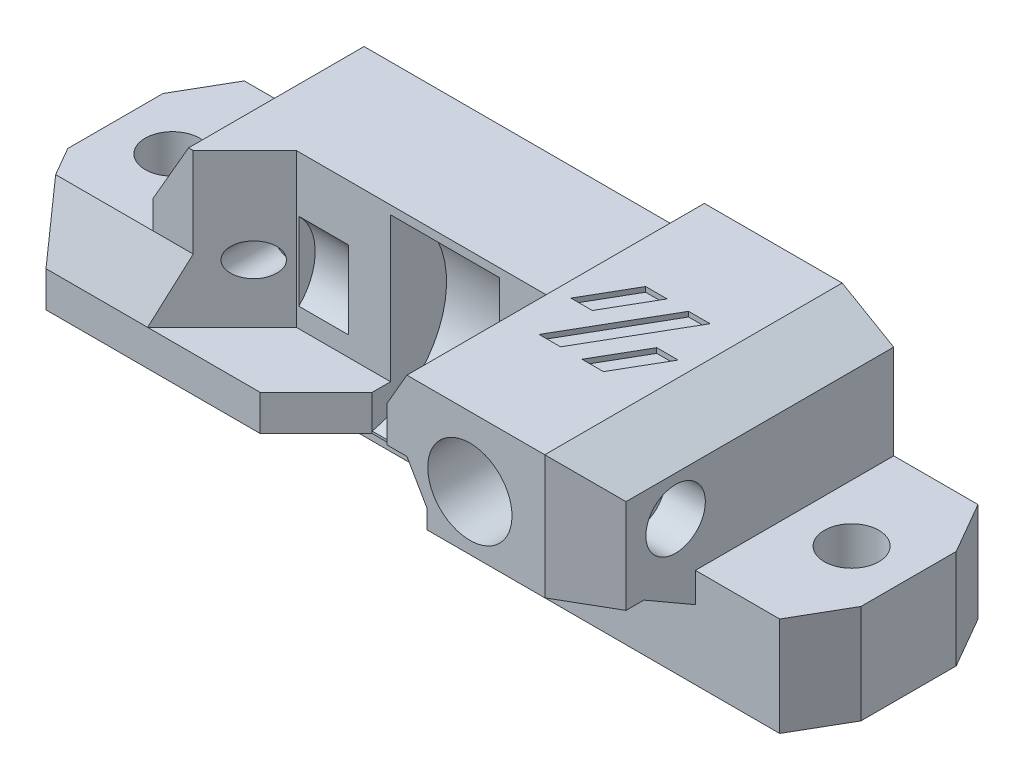
from build123d import *
from OCP.BRepFilletAPI import BRepFilletAPI_MakeChamfer

# Parameters (mm, degrees)
AUFSATZ_LINEAR_AUSTRAGEN1_DEPTH       = 80
SKIZZE2_R                             = 4.25
SCHNITT_LINEAR_AUSTRAGEN1_DEPTH       = 30
SKIZZE3_R                             = 1.65
SCHNITT_LINEAR_AUSTRAGEN2_DEPTH       = 17.5
SKIZZE4_R                             = 1.65
SCHNITT_LINEAR_AUSTRAGEN3_DEPTH       = 30
SCHNITT_LINEAR_START                  = -22.5
SKIZZE5_R                             = 2.75
SCHNITT_LINEAR_AUSTRAGEN4_DEPTH       = 22.5
SKIZZE6_R                             = 2.75
SCHNITT_LINEAR_AUSTRAGEN5_DEPTH       = 10
SCHNITT_LINEAR_AUSTRAGEN6_DEPTH       = 9.5
SCHNITT_LINEAR_START_2                = -12.5
SKIZZE8_W                             = 11.5
SKIZZE8_H                             = 12.5
SCHNITT_LINEAR_AUSTRAGEN7_DEPTH       = 30
SCHNITT_LINEAR_START_3                = 10.2
SKIZZE9_W                             = 4.714359354
SKIZZE9_H                             = 17.5
SCHNITT_LINEAR_AUSTRAGEN8_DEPTH       = 11
SCHNITT_LINEAR_START_4                = 25.45
SKIZZE10_R                            = 5.5
SCHNITT_LINEAR_AUSTRAGEN9_DEPTH       = 5
AUFSATZ_LINEAR_START                  = -19.04526
AUFSATZ_LINEAR_AUSTRAGEN2_DEPTH       = 15.44526
SCHNITT_LINEAR_START_5                = -20.5
SKIZZE12_R                            = 1.65
SCHNITT_LINEAR_AUSTRAGEN10_DEPTH      = 20.5
FASE1_SIZE                            = 1.6
SKIZZE15_W                            = 20
SKIZZE15_H                            = 10
SCHNITT_LINEAR_AUSTRAGEN12_DEPTH      = 80
SCHNITT_LINEAR_AUSTRAGEN13_REACH      = 86.633
SKIZZE17_W                            = 49.404551733
SKIZZE17_H                            = 10
SCHNITT_LINEAR_AUSTRAGEN14_DEPTH      = 3.6
AUFSATZ_LINEAR_AUSTRAGEN3_REACH       = 87.477
SKIZZE21_W                            = 10
SKIZZE21_H                            = 10
SCHNITT_LINEAR_AUSTRAGEN18_DEPTH      = 30.595448267
SCHNITT_LINEAR_AUSTRAGEN19_REACH      = 76.823
SCHNITT_LINEAR_AUSTRAGEN19_END_RADIUS = 4.25
SKIZZE22_R                            = 2.25
SKIZZE23_R                            = 3
SCHNITT_LINEAR_AUSTRAGEN20_DEPTH      = 4
FASE2_SIZE                            = 3
FASE2_SIZE2                           = 5.196152423
AUFSATZ_LINEAR_START_2                = -17
AUFSATZ_LINEAR_AUSTRAGEN4_DEPTH       = 46
FASE3_SIZE                            = 3
FASE3_SIZE2                           = 5.196152423
FASE4_SIZE                            = 3
FASE4_SIZE2                           = 5.196152423
SCHNITT_LINEAR_AUSTRAGEN22_DEPTH      = 0.5
SCHNITT_LINEAR_AUSTRAGEN23_REACH      = 87.477
K_RPER_VERSCHIEBEN_KOPIEREN1_ANGLE    = 90


with BuildPart() as part:
    # Skizze1 → Aufsatz-Linear austragen1 (new body)
    with BuildSketch(Plane(origin=(0, 0, 0), x_dir=(0, 0, -1), z_dir=(1, 0, 0))):
        Polygon((0, 0), (0, 20), (-22.5, 20), (-22.5, -10), (20, -10), (20, 0), align=None)
    extrude(amount=AUFSATZ_LINEAR_AUSTRAGEN1_DEPTH)

    # Skizze2 → Schnitt-Linear austragen1 (cut)
    with BuildSketch(Plane(origin=(0, 20, 0), x_dir=(1, 0, 0), z_dir=(0, 1, 0))):
        with Locations(Location((55.75, -15.5, 0), (0, 0, 270))):
            Circle(SKIZZE2_R)
    extrude(amount=-SCHNITT_LINEAR_AUSTRAGEN1_DEPTH, mode=Mode.SUBTRACT)

    # Skizze3 → Schnitt-Linear austragen2 (cut)
    with BuildSketch(Plane.XZ.offset(10)):
        Polygon((49.399147039, 22.5), (47.404551733, 19.045259589), (47.404551733, 15.4), (49.404551733, 15.4), (51.45, 11.857179677), (51.45, 7.142820323), (49.404551733, 3.6), (17.595448267, 3.6), (15.55, 7.142820323), (15.55, 11.857179677), (17.595448267, 15.4), (19.595448267, 15.4), (19.595448267, 19.045259589), (0, 19.045259589), (0, 22.5), align=None)
        with Locations(Location((48.4, 9.5, 0), (0, 0, 270))):
            Circle(SKIZZE3_R, mode=Mode.SUBTRACT)
        with Locations(Location((18.6, 9.5, 0), (0, 0, 270))):
            Circle(SKIZZE3_R, mode=Mode.SUBTRACT)
    extrude(amount=-SCHNITT_LINEAR_AUSTRAGEN2_DEPTH, mode=Mode.SUBTRACT)

    # Skizze4 → Schnitt-Linear austragen3 (cut)
    with BuildSketch(Plane.XZ.offset(10)):
        with Locations(Location((18.6, 9.5, 0), (0, 0, 270))):
            Circle(SKIZZE4_R)
        with Locations(Location((48.4, 9.5, 0), (0, 0, 270))):
            Circle(SKIZZE4_R)
    extrude(amount=-SCHNITT_LINEAR_AUSTRAGEN3_DEPTH, mode=Mode.SUBTRACT)

    # Skizze5 → Schnitt-Linear austragen4 (cut)
    with BuildSketch(Plane(origin=(0, 0, 0), x_dir=(-1, 0, 0), z_dir=(0, 0, -1)).offset(SCHNITT_LINEAR_START)):
        with Locations((-5.75, 10)):
            Circle(SKIZZE5_R)
        with Locations((-74.25, 10)):
            Circle(SKIZZE5_R)
    extrude(amount=SCHNITT_LINEAR_AUSTRAGEN4_DEPTH, mode=Mode.SUBTRACT)

    # Skizze6 → Schnitt-Linear austragen5 (cut)
    with BuildSketch(Plane(origin=(0, 0, 0), x_dir=(1, 0, 0), z_dir=(0, 1, 0))):
        with Locations(Location((40, 10, 0), (0, 0, 270))):
            Circle(SKIZZE6_R)
    extrude(amount=-SCHNITT_LINEAR_AUSTRAGEN5_DEPTH, mode=Mode.SUBTRACT)

    # Skizze7 → Schnitt-Linear austragen6 (cut)
    with BuildSketch(Plane(origin=(0, 20, 0), x_dir=(1, 0, 0), z_dir=(0, 1, 0))):
        Polygon((21.890896534, -9.5), (20.245448267, -6.65), (16.954551733, -6.65), (15.309103466, -9.5), (16.954551733, -12.35), (20.245448267, -12.35), align=None)
        Polygon((51.690896534, -9.5), (50.045448267, -6.65), (46.754551733, -6.65), (45.109103466, -9.5), (46.754551733, -12.35), (50.045448267, -12.35), align=None)
    extrude(amount=-SCHNITT_LINEAR_AUSTRAGEN6_DEPTH, mode=Mode.SUBTRACT)

    # Skizze8 → Schnitt-Linear austragen7 (cut)
    with BuildSketch(Plane.XZ.offset(-7.5).offset(SCHNITT_LINEAR_START_2)):
        Polygon((49.399147039, 22.5), (47.404551733, 19.045259589), (15.081237719, 19.045259589), (11.5, 12.842373906), (11.5, 10), (0, 10), (0, 22.5), align=None)
        with Locations((74.25, 16.25)):
            Rectangle(SKIZZE8_W, SKIZZE8_H)
    extrude(amount=SCHNITT_LINEAR_AUSTRAGEN7_DEPTH, mode=Mode.SUBTRACT)

    # Skizze9 → Schnitt-Linear austragen8 (cut)
    with BuildSketch(Plane.ZY.offset(-51.45).offset(SCHNITT_LINEAR_START_3)):
        with BuildLine():
            ThreePointArc((19, 3.65), (9.5, 13.15), (0, 3.65))
            Line((0, 3.65), (0, -10))
            Line((0, -10), (7.142820323, -10))
            Line((7.142820323, -10), (7.142820323, 7.5))
            Line((7.142820323, 7.5), (11.857179677, 7.5))
            Line((11.857179677, 7.5), (11.857179677, -10))
            Line((11.857179677, -10), (19, -10))
            Line((19, -10), (19, 3.65))
        make_face()
        with Locations((9.5, -1.25)):
            Rectangle(SKIZZE9_W, SKIZZE9_H)
    extrude(amount=SCHNITT_LINEAR_AUSTRAGEN8_DEPTH, mode=Mode.SUBTRACT)

    # Skizze10 → Schnitt-Linear austragen9 (cut)
    with BuildSketch(Plane.ZY.offset(-51.45).offset(SCHNITT_LINEAR_START_4)):
        with Locations((9.5, 3.65)):
            Circle(SKIZZE10_R)
    extrude(amount=SCHNITT_LINEAR_AUSTRAGEN9_DEPTH, mode=Mode.SUBTRACT)


with BuildPart() as aufsatz_linear_austragen2_tool:
    # Skizze11 → Aufsatz-Linear austragen2 (new body)
    with BuildSketch(Plane(origin=(0, 0, 0), x_dir=(-1, 0, 0), z_dir=(0, 0, -1)).offset(AUFSATZ_LINEAR_START)):
        Polygon((-15.55, 7.5), (-20.75, 7.5), (-15.55, 2.3), align=None)
        Polygon((-51.45, 2.3), (-46.25, 7.5), (-51.45, 7.5), align=None)
    extrude(amount=AUFSATZ_LINEAR_AUSTRAGEN2_DEPTH)


with BuildPart() as part_1:
    add(part.part)


with BuildPart() as part_2:
    # Aufsatz-Linear austragen2: joined with aufsatz_linear_austragen2_tool
    add(part_1.part.fuse(aufsatz_linear_austragen2_tool.part, tol=0.00001))

    # Skizze12 → Schnitt-Linear austragen10 (cut)
    with BuildSketch(Plane(origin=(0, 10.5, 0), x_dir=(1, 0, 0), z_dir=(0, 1, 0)).offset(SCHNITT_LINEAR_START_5)):
        with Locations(Location((18.6, -9.5, 0), (0, 0, 90))):
            Circle(SKIZZE12_R)
        with Locations(Location((48.4, -9.5, 0), (0, 0, 90))):
            Circle(SKIZZE12_R)
    extrude(amount=SCHNITT_LINEAR_AUSTRAGEN10_DEPTH, mode=Mode.SUBTRACT)

    # Fase1
    # the kernel refuses this chamfer: 1.6 mm, written as the material it takes off along each edge
    with BuildSketch(Plane(origin=(18.6, 10.5, 9.5), x_dir=(0, 0, -1), z_dir=(-1, 0, 0))) as fase1_piece_1_section:
        Polygon((1.65 + FASE1_SIZE, 0), (1.65, FASE1_SIZE), (1.65, 0), align=None)
    fase1_piece_1 = revolve(axis=Axis((18.6, 10.5, 9.5), (0, -1, 0)), mode=Mode.PRIVATE)
    fase1_piece_1 = split(fase1_piece_1, bisect_by=Plane(origin=(21.068172401, 10.5, 10.925), z_dir=(-0.8660254037844387, 0, -0.4999999999999999)), keep=Keep.TOP, mode=Mode.PRIVATE)
    fase1_piece_1 = split(fase1_piece_1, bisect_by=Plane(origin=(18.6, 10.5, 12.35), z_dir=(0, 0, -1)), keep=Keep.TOP, mode=Mode.PRIVATE)
    fase1_piece_1 = split(fase1_piece_1, bisect_by=Plane(origin=(21.068172401, 10.5, 8.075), z_dir=(-0.8660254037844402, 0, 0.49999999999999756)), keep=Keep.TOP, mode=Mode.PRIVATE)
    fase1_piece_1 = split(fase1_piece_1, bisect_by=Plane(origin=(16.131827599, 10.5, 10.925), z_dir=(0.8660254037844385, 0, -0.5000000000000002)), keep=Keep.TOP, mode=Mode.PRIVATE)
    fase1_piece_1 = split(fase1_piece_1, bisect_by=Plane(origin=(18.6, 10.5, 6.65), z_dir=(0, 0, 1)), keep=Keep.TOP, mode=Mode.PRIVATE)
    fase1_piece_1 = split(fase1_piece_1, bisect_by=Plane(origin=(16.131827599, 10.5, 8.075), z_dir=(0.8660254037844384, 0, 0.5000000000000004)), keep=Keep.TOP, mode=Mode.PRIVATE)
    add(fase1_piece_1, mode=Mode.SUBTRACT)
    with BuildSketch(Plane(origin=(48.4, 10.5, 9.5), x_dir=(0, 0, -1), z_dir=(-1, 0, 0))) as fase1_piece_2_section:
        Polygon((1.65 + FASE1_SIZE, 0), (1.65, FASE1_SIZE), (1.65, 0), align=None)
    fase1_piece_2 = revolve(axis=Axis((48.4, 10.5, 9.5), (0, -1, 0)), mode=Mode.PRIVATE)
    fase1_piece_2 = split(fase1_piece_2, bisect_by=Plane(origin=(50.868172401, 10.5, 10.925), z_dir=(-0.8660254037844388, 0, -0.4999999999999996)), keep=Keep.TOP, mode=Mode.PRIVATE)
    fase1_piece_2 = split(fase1_piece_2, bisect_by=Plane(origin=(48.4, 10.5, 12.35), z_dir=(0, 0, -1)), keep=Keep.TOP, mode=Mode.PRIVATE)
    fase1_piece_2 = split(fase1_piece_2, bisect_by=Plane(origin=(50.868172401, 10.5, 8.075), z_dir=(-0.8660254037844392, 0, 0.49999999999999906)), keep=Keep.TOP, mode=Mode.PRIVATE)
    fase1_piece_2 = split(fase1_piece_2, bisect_by=Plane(origin=(45.931827599, 10.5, 10.925), z_dir=(0.8660254037844384, 0, -0.5000000000000006)), keep=Keep.TOP, mode=Mode.PRIVATE)
    fase1_piece_2 = split(fase1_piece_2, bisect_by=Plane(origin=(48.4, 10.5, 6.65), z_dir=(0, 0, 1)), keep=Keep.TOP, mode=Mode.PRIVATE)
    fase1_piece_2 = split(fase1_piece_2, bisect_by=Plane(origin=(45.931827599, 10.5, 8.075), z_dir=(0.8660254037844385, 0, 0.5000000000000003)), keep=Keep.TOP, mode=Mode.PRIVATE)
    add(fase1_piece_2, mode=Mode.SUBTRACT)

    # Skizze15 → Schnitt-Linear austragen12 (cut)
    with BuildSketch(Plane(origin=(80, 0, 0), x_dir=(0, 0, -1), z_dir=(1, 0, 0))):
        with Locations((10, -5)):
            Rectangle(SKIZZE15_W, SKIZZE15_H)
    extrude(amount=-SCHNITT_LINEAR_AUSTRAGEN12_DEPTH, mode=Mode.SUBTRACT)

    # Schnitt-Linear austragen13: up to this face of the body (flat: up to its plane)
    schnitt_linear_austragen13_end = Plane(part_2.part.faces().sort_by_distance((45.217967345, -1.528115299, 3.6))[0])
    # Skizze16 → Schnitt-Linear austragen13 (cut, up to the picked face)
    with BuildSketch(Plane.XY.offset(19.045259589), mode=Mode.PRIVATE) as schnitt_linear_austragen13_sk1:
        Polygon((0, -10), (0, 2.3), (15.55, 2.3), (19.595448267, 6.345448267), (19.595448267, -10), align=None)
    schnitt_linear_austragen13_tool1 = split(extrude(schnitt_linear_austragen13_sk1.sketch, amount=-SCHNITT_LINEAR_AUSTRAGEN13_REACH, mode=Mode.PRIVATE), bisect_by=schnitt_linear_austragen13_end, keep=Keep.BOTH, mode=Mode.PRIVATE)
    add(schnitt_linear_austragen13_tool1.solids().sort_by(Axis((10.075159, -3.603784, 19.04526), (0, 0, -1)))[0], mode=Mode.SUBTRACT)

    # Skizze17 → Schnitt-Linear austragen14 (cut)
    with BuildSketch(Plane.XY.offset(3.6)):
        with Locations((24.702275867, -5)):
            Rectangle(SKIZZE17_W, SKIZZE17_H)
    extrude(amount=-SCHNITT_LINEAR_AUSTRAGEN14_DEPTH, mode=Mode.SUBTRACT)

    # Aufsatz-Linear austragen3: up to this plane
    aufsatz_linear_austragen3_end = Plane(origin=(-0.5159461, -13.7659461, 26.399170114), z_dir=(0.7071067811865436, -0.7071067811865516, 0))
    # Skizze20 → Aufsatz-Linear austragen3 (add, up to the surface)
    with BuildSketch(Plane.ZY, mode=Mode.PRIVATE) as aufsatz_linear_austragen3_sk1:
        Polygon((10, 2.3), (3.6, 2.3), (3.6, 0), align=None)
    aufsatz_linear_austragen3_tool1 = split(extrude(aufsatz_linear_austragen3_sk1.sketch, amount=-AUFSATZ_LINEAR_AUSTRAGEN3_REACH, mode=Mode.PRIVATE), bisect_by=aufsatz_linear_austragen3_end, keep=Keep.BOTH, mode=Mode.PRIVATE)
    add(aufsatz_linear_austragen3_tool1.solids().sort_by_distance((0, 1.533333, 5.733333))[0])

    # Skizze21 → Schnitt-Linear austragen18 (cut)
    with BuildSketch(Plane(origin=(80, 0, 0), x_dir=(0, 0, -1), z_dir=(1, 0, 0))):
        with Locations((-5, -5)):
            Rectangle(SKIZZE21_W, SKIZZE21_H)
    extrude(amount=-SCHNITT_LINEAR_AUSTRAGEN18_DEPTH, mode=Mode.SUBTRACT)

    # Schnitt-Linear austragen19: up to this cylinder (the profile starts outside it)
    schnitt_linear_austragen19_end = Plane(origin=(55.75, -2, 15.5), z_dir=(0, 1, 0)) * Cylinder(SCHNITT_LINEAR_AUSTRAGEN19_END_RADIUS, 163.146, mode=Mode.PRIVATE)
    # Skizze22 → Schnitt-Linear austragen19 (cut, up to the surface)
    with BuildSketch(Plane(origin=(68.5, 0, 0), x_dir=(0, 0, -1), z_dir=(1, 0, 0)), mode=Mode.PRIVATE) as schnitt_linear_austragen19_sk1:
        with Locations((-15.5, -2)):
            Circle(SKIZZE22_R)
    schnitt_linear_austragen19_tool1 = extrude(schnitt_linear_austragen19_sk1.sketch, amount=-SCHNITT_LINEAR_AUSTRAGEN19_REACH, mode=Mode.PRIVATE) - schnitt_linear_austragen19_end
    add(schnitt_linear_austragen19_tool1.solids().sort_by_distance((68.5, -2, 15.5))[0], mode=Mode.SUBTRACT)

    # Skizze23 → Schnitt-Linear austragen20 (cut)
    with BuildSketch(Plane(origin=(68.5, 0, 0), x_dir=(0, 0, -1), z_dir=(1, 0, 0))):
        with Locations((-15.5, -2)):
            Circle(SKIZZE23_R)
    extrude(amount=-SCHNITT_LINEAR_AUSTRAGEN20_DEPTH, mode=Mode.SUBTRACT)

    # Fase2
    fase2_edges = [part_2.edges().sort_by_distance(p)[0] for p in [
        (68.5, 5, 22.5),
    ]]
    fase2_side = [part_2.faces().sort_by_distance(p)[0] for p in [
        (68.5, 5.5708269, 16.311160025),
    ]]
    chamfer(fase2_edges, length=FASE2_SIZE, length2=FASE2_SIZE2, reference=fase2_side[0])

    # Skizze24 → Aufsatz-Linear austragen4 (add)
    with BuildSketch(Plane(origin=(80, 0, 0), x_dir=(0, 0, -1), z_dir=(1, 0, 0)).offset(AUFSATZ_LINEAR_START_2)):
        Polygon((2, 11), (0, 13), (0, 7), (2, 7), align=None)
    extrude(amount=-AUFSATZ_LINEAR_AUSTRAGEN4_DEPTH)

    # Fase3: one chamfer whose edges measure the first distance from different faces: ONE call of the kernel's chamfer builder (chamfer() names one face for all edges)
    fase3_edges_1 = [part_2.edges().sort_by_distance(p)[0] for p in [
        (80, 20, 5),
        (0, 20, 5),
    ]]
    fase3_side_1 = [part_2.faces().sort_by_distance(p)[0] for p in [
        (40.67612784, 20, 8.90405886),
    ]]
    fase3_edges_2 = [part_2.edges().sort_by_distance(p)[0] for p in [
        (68.5, -10, 14.75),
    ]]
    fase3_side_2 = [part_2.faces().sort_by_distance(p)[0] for p in [
        (68.5, 5.770940982, 14.66739918),
    ]]
    fase3_edges_3 = [part_2.edges().sort_by_distance(p)[0] for p in [
        (0, 0, 1.8),
    ]]
    fase3_side_3 = [part_2.faces().sort_by_distance(p)[0] for p in [
        (15.125, 0, 1.8),
    ]]
    fase3_edges_4 = [part_2.edges().sort_by_distance(p)[0] for p in [
        (80, 0, 5),
    ]]
    fase3_side_4 = [part_2.faces().sort_by_distance(p)[0] for p in [
        (63.375271211, 0, 4.636949062),
    ]]
    fase3 = BRepFilletAPI_MakeChamfer(part_2.part.solid().wrapped)
    for e in fase3_edges_1:
        fase3.Add(FASE3_SIZE, FASE3_SIZE2, e.wrapped, fase3_side_1[0].wrapped)  # the first distance lies on this face
    for e in fase3_edges_2:
        fase3.Add(FASE3_SIZE, FASE3_SIZE2, e.wrapped, fase3_side_2[0].wrapped)  # the first distance lies on this face
    for e in fase3_edges_3:
        fase3.Add(FASE3_SIZE, FASE3_SIZE2, e.wrapped, fase3_side_3[0].wrapped)  # the first distance lies on this face
    for e in fase3_edges_4:
        fase3.Add(FASE3_SIZE, FASE3_SIZE2, e.wrapped, fase3_side_4[0].wrapped)  # the first distance lies on this face
    add(Compound.cast(fase3.Shape()), mode=Mode.REPLACE)

    # Fase4
    fase4_edges = [part_2.edges().sort_by_distance(p)[0] for p in [
        (59.975, 0, 10),
    ]]
    fase4_side = [part_2.faces().sort_by_distance(p)[0] for p in [
        (61.841547713, 0, 4.600133873),
    ]]
    chamfer(fase4_edges, length=FASE4_SIZE, length2=FASE4_SIZE2, reference=fase4_side[0])

    # Skizze27 → Schnitt-Linear austragen22 (cut)
    with BuildSketch(Plane.XY.offset(22.5)):
        Polygon((58.028773175, 9.780127019), (60.193836684, 9.780127019), (54.674221442, 0.219872981), (52.509157932, 0.219872981), align=None)
        Polygon((53.698646156, 9.780127019), (55.863709665, 9.780127019), (53.103902044, 5), (50.938838534, 5), align=None)
        Polygon((59.599092572, 5), (56.839284951, 0.219872981), (59.004348461, 0.219872981), (61.764156082, 5), align=None)
    extrude(amount=-SCHNITT_LINEAR_AUSTRAGEN22_DEPTH, mode=Mode.SUBTRACT)

    # Schnitt-Linear austragen23: up to this face of the body (flat: up to its plane)
    schnitt_linear_austragen23_end = Plane(part_2.part.faces().sort_by_distance((45.059315542, 3.511023134, 3.6))[0])
    # Skizze28 → Schnitt-Linear austragen23 (cut, up to the picked face)
    with BuildSketch(Plane(origin=(0, 0, 0), x_dir=(-1, 0, 0), z_dir=(0, 0, -1)), mode=Mode.PRIVATE) as schnitt_linear_austragen23_sk1:
        Polygon((-30.25, 5.65), (-24.6, 0), (-46.9, 0), (-41.25, 5.65), align=None)
    schnitt_linear_austragen23_tool1 = split(extrude(schnitt_linear_austragen23_sk1.sketch, amount=-SCHNITT_LINEAR_AUSTRAGEN23_REACH, mode=Mode.PRIVATE), bisect_by=schnitt_linear_austragen23_end, keep=Keep.BOTH, mode=Mode.PRIVATE)
    add(schnitt_linear_austragen23_tool1.solids().sort_by(Axis((35.75, 2.505455, 0), (0, 0, 1)))[0], mode=Mode.SUBTRACT)


with BuildPart() as part_3:
    # Körper-Verschieben/Kopieren1: moved
    add(part_2.part.rotate(Axis((0, 5, 10), (-1, 0, 0)), K_RPER_VERSCHIEBEN_KOPIEREN1_ANGLE))


solid = part_3.part
